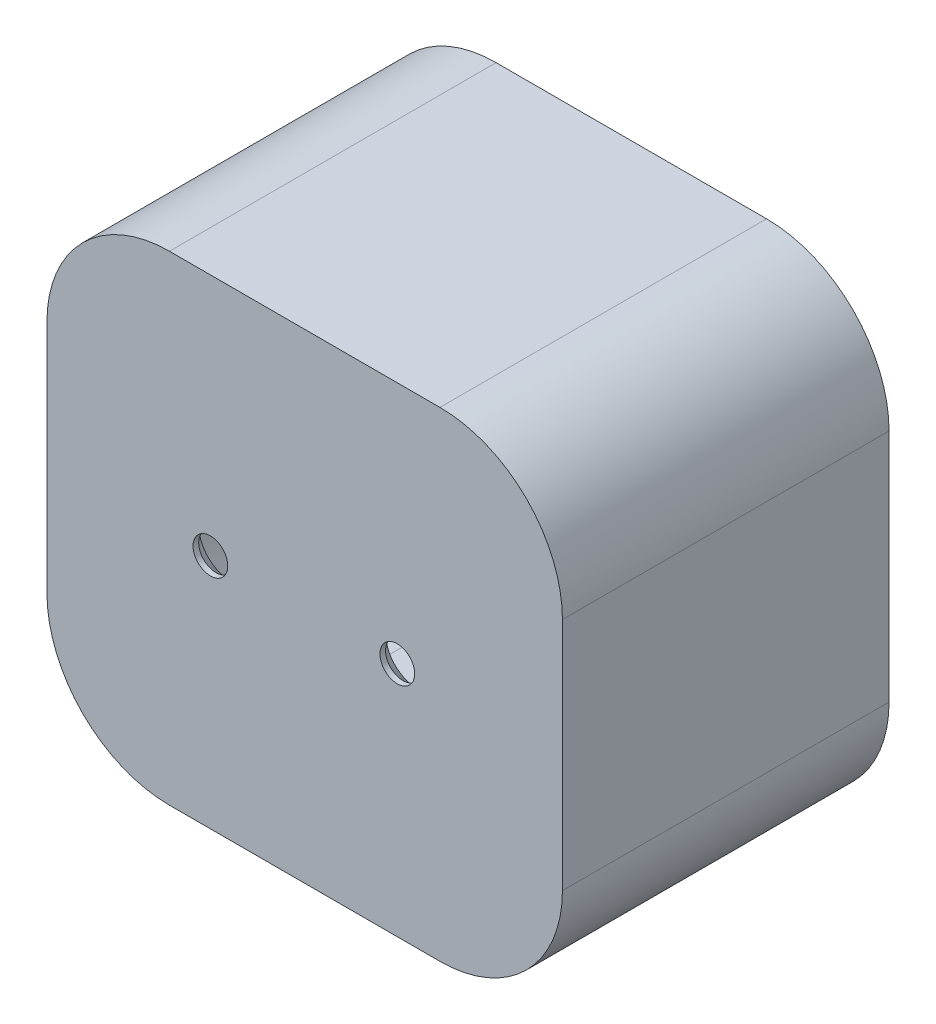
from build123d import *

# Parameters (mm, degrees)
RESSALTO_EXTRUS_O1_DEPTH                     = 30
CASCA1_START                                 = -36.5
CASCA1_OUTLINE_W                             = 43
CASCA1_OUTLINE_H                             = 30
CASCA1_DEPTH                                 = 26.5
CASCA1_2_DEPTH                               = 26.5
CASCA1_3_DEPTH                               = 30
CASCA1_4_DEPTH                               = 32
CASCA1_START_2                               = 30
CASCA1_5_DEPTH                               = 2
ESCAREADO_PARA_PARAFUSO_COM_CABE_A_E_2_COUNT = 2
ESCAREADO_PARA_PARAFUSO_COM_CABE_A_E_2_PITCH = 18.308687804


with BuildPart() as part:
    # Esboço1 → Ressalto-extrusão1 (new body)
    with BuildSketch(Plane.XY):
        with BuildLine():
            Line((-10, 0), (-36.5, 0))
            ThreePointArc((-36.5, 0), (-43.571067812, 2.928932188), (-46.5, 10))
            Line((-46.5, 10), (-46.5, 33))
            ThreePointArc((-46.5, 33), (-43.571067812, 40.071067812), (-36.5, 43))
            Line((-36.5, 43), (-10, 43))
            ThreePointArc((-10, 43), (-2.928932188, 40.071067812), (0, 33))
            Line((0, 33), (0, 10))
            ThreePointArc((0, 10), (-2.928932188, 2.928932188), (-10, 0))
        make_face()
    extrude(amount=RESSALTO_EXTRUS_O1_DEPTH)

    # Casca1: read off the stored shape, not the designer's step
    # Casca1 outline → Casca1 (cut)
    with BuildSketch(Plane.YZ.offset(CASCA1_START)):
        with Locations((21.5, 15)):
            Rectangle(CASCA1_OUTLINE_W, CASCA1_OUTLINE_H)
    extrude(amount=CASCA1_DEPTH, mode=Mode.SUBTRACT)

    # Casca1 2 outline → Casca1 2 (add)
    with BuildSketch(Plane.YZ.offset(CASCA1_START)):
        Polygon((-2, 32), (-2, 0), (0, 0), (0, 30), (43, 30), (43, 0), (45, 0), (45, 32), align=None)
    extrude(amount=CASCA1_2_DEPTH)

    # Casca1 3 outline → Casca1 3 (cut)
    with BuildSketch(Plane.XY):
        with BuildLine():
            Line((-36.5, 0), (-36.5, 43))
            ThreePointArc((-36.5, 43), (-43.571067812, 40.071067812), (-46.5, 33))
            Line((-46.5, 33), (-46.5, 10))
            ThreePointArc((-46.5, 10), (-43.571067812, 2.928932188), (-36.5, 0))
        make_face()
        with BuildLine():
            Line((-10, 43), (-10, 0))
            ThreePointArc((-10, 0), (-2.928932188, 2.928932188), (0, 10))
            Line((0, 10), (0, 33))
            ThreePointArc((0, 33), (-2.928932188, 40.071067812), (-10, 43))
        make_face()
    extrude(amount=CASCA1_3_DEPTH, mode=Mode.SUBTRACT)

    # Casca1 4 outline → Casca1 4 (add)
    with BuildSketch(Plane.XY):
        with BuildLine():
            ThreePointArc((-36.5, 45), (-44.985281374, 41.485281374), (-48.5, 33))
            Line((-48.5, 33), (-48.5, 10))
            ThreePointArc((-48.5, 10), (-44.985281374, 1.514718626), (-36.5, -2))
            Line((-36.5, -2), (-36.5, 0))
            ThreePointArc((-36.5, 0), (-43.571067812, 2.928932188), (-46.5, 10))
            Line((-46.5, 10), (-46.5, 33))
            ThreePointArc((-46.5, 33), (-43.571067812, 40.071067812), (-36.5, 43))
            Line((-36.5, 43), (-36.5, 45))
        make_face()
        with BuildLine():
            ThreePointArc((-10, -2), (-1.514718626, 1.514718626), (2, 10))
            Line((2, 10), (2, 33))
            ThreePointArc((2, 33), (-1.514718626, 41.485281374), (-10, 45))
            Line((-10, 45), (-10, 43))
            ThreePointArc((-10, 43), (-2.928932188, 40.071067812), (0, 33))
            Line((0, 33), (0, 10))
            ThreePointArc((0, 10), (-2.928932188, 2.928932188), (-10, 0))
            Line((-10, 0), (-10, -2))
        make_face()
    extrude(amount=CASCA1_4_DEPTH)

    # Casca1 5 outline → Casca1 5 (add)
    with BuildSketch(Plane.XY.offset(CASCA1_START_2)):
        with BuildLine():
            Line((-36.5, 0), (-36.5, 43))
            ThreePointArc((-36.5, 43), (-43.571067812, 40.071067812), (-46.5, 33))
            Line((-46.5, 33), (-46.5, 10))
            ThreePointArc((-46.5, 10), (-43.571067812, 2.928932188), (-36.5, 0))
        make_face()
        with BuildLine():
            Line((-10, 43), (-10, 0))
            ThreePointArc((-10, 0), (-2.928932188, 2.928932188), (0, 10))
            Line((0, 10), (0, 33))
            ThreePointArc((0, 33), (-2.928932188, 40.071067812), (-10, 43))
        make_face()
    extrude(amount=CASCA1_5_DEPTH)

    # Esboço4 → Escareado para parafuso com cabeça escareada chata de M31 (revolve, cut)
    with BuildSketch(Plane(origin=(-32.48511858, 21.158156033, 30), x_dir=(0, 1, 0), z_dir=(1, 0, 0))):
        Polygon((0, 0), (0, 2), (1.7, 2), (1.7, 1.45), (3.15, 0), align=None)
    escareado_para_parafuso_com_cabe_a_escar = revolve(axis=Axis((-32.48511858, 21.158156033, 23.65), (0, 0, 1)), mode=Mode.SUBTRACT)

    # Escareado para parafuso com cabe_a e 2: Escareado para parafuso com cabeça escareada chata de M31 ×2
    with Locations(*[(i * ESCAREADO_PARA_PARAFUSO_COM_CABE_A_E_2_PITCH, 0, 0) for i in range(1, ESCAREADO_PARA_PARAFUSO_COM_CABE_A_E_2_COUNT)]):
        add(escareado_para_parafuso_com_cabe_a_escar, mode=Mode.SUBTRACT)


solid = part.part
